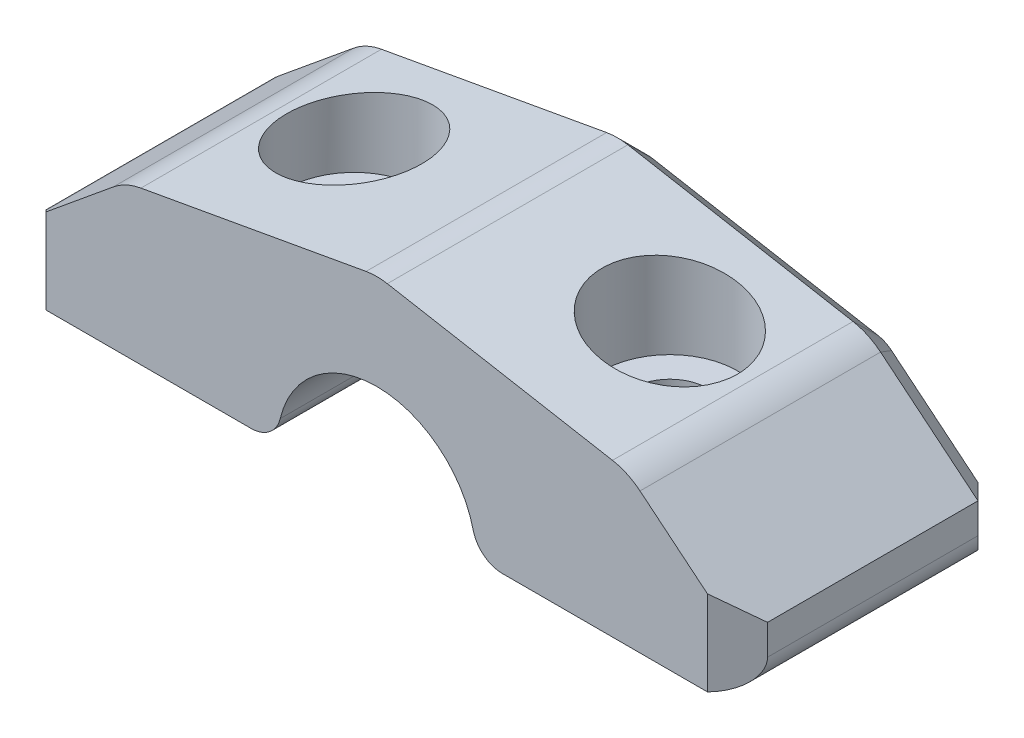
from build123d import *

# Parameters (mm, degrees)
BOSS_EXTRUDE1_DEPTH     = 9
CUT_EXTRUDE1_DEPTH      = 17.347782724
CUT_EXTRUDE1_DEPTH_BACK = 17.347782724
CHAMFER1_SIZE           = 1
FILLET3_R               = 1
SKETCH4_R               = 1.25
CUT_EXTRUDE2_DEPTH      = 17.347782724
CUT_EXTRUDE3_START      = 3
SKETCH5_R               = 2.25
CUT_EXTRUDE3_DEPTH      = 10
FILLET2_R               = 2
CHAMFER2_SIZE           = 1


with BuildPart() as part:
    # Sketch1 → Boss-Extrude1 (new body)
    with BuildSketch(Plane.XY):
        with BuildLine():
            Line((-3.3, 0), (-12, 0))
            Line((-12, 0), (-12, 6.5))
            Line((-12, 6.5), (12, 6.5))
            Line((12, 6.5), (12, 0))
            Line((12, 0), (3.3, 0))
            ThreePointArc((3.3, 0), (0, 3.3), (-3.3, 0))
        make_face()
    extrude(amount=BOSS_EXTRUDE1_DEPTH)

    # Sketch2 → Cut-Extrude1 (cut, two sides: drawn at the far end of the back side and taken through both)
    with BuildSketch(Plane.XY.offset(9).offset(-CUT_EXTRUDE1_DEPTH_BACK)):
        Polygon((-8.355690819, 5), (0, 6.5), (-12, 6.5), (-12, 2.004439372), align=None)
        Polygon((12, 6.5), (0, 6.5), (8.355690819, 5), (12, 2.004439372), align=None)
    extrude(amount=CUT_EXTRUDE1_DEPTH + CUT_EXTRUDE1_DEPTH_BACK, mode=Mode.SUBTRACT)

    # Chamfer1
    chamfer1_edges = [part.edges().sort_by_distance(p)[0] for p in [
        (12, 1.002219686, 9),
        (-12, 1.002219686, 0),
        (-12, 1.002219686, 9),
        (12, 1.002219686, 0),
    ]]
    chamfer(chamfer1_edges, length=CHAMFER1_SIZE)

    # Fillet3
    fillet3_edges = [part.edges().sort_by_distance(p)[0] for p in [
        (12, 0, 4.5),
        (3.3, 0, 4.5),
        (-12, 0, 4.5),
        (-3.3, 0, 4.5),
    ]]
    fillet(fillet3_edges, radius=FILLET3_R)

    # Sketch4 → Cut-Extrude2 (cut, through all)
    with BuildSketch(Plane.XZ):
        with Locations(Location((-5.25, 4.5, 0), (0, 0, 31.315725107))):
            Circle(SKETCH4_R)
        with Locations((5.25, 4.5)):
            Circle(SKETCH4_R)
    extrude(amount=-CUT_EXTRUDE2_DEPTH, mode=Mode.SUBTRACT)

    # Sketch5 → Cut-Extrude3 (cut)
    with BuildSketch(Plane(origin=(0, 0, 0), x_dir=(1, 0, 0), z_dir=(0, 1, 0)).offset(CUT_EXTRUDE3_START)):
        with Locations(Location((-5.25, -4.5, 0), (0, 0, 180))):
            Circle(SKETCH5_R)
        with Locations((5.25, -4.5)):
            Circle(SKETCH5_R)
    extrude(amount=CUT_EXTRUDE3_DEPTH, mode=Mode.SUBTRACT)

    # Fillet2
    fillet2_edges = [part.edges().sort_by_distance(p)[0] for p in [
        (8.355690819, 5, 4.5),
        (-8.355690819, 5, 4.5),
        (0, 6.5, 4.5),
        (-12, 2.004439372, 4.5),
    ]]
    fillet(fillet2_edges, radius=FILLET2_R)

    # Chamfer2
    chamfer2_edges = [part.edges().sort_by_distance(p)[0] for p in [
        (7.591052367, 0, 0),
        (3.562652612, 0.214965561, 0),
        (0, 3.3, 0),
        (-3.562652612, 0.214965561, 0),
        (-7.591052367, 0, 0),
    ]]
    chamfer(chamfer2_edges, length=CHAMFER2_SIZE)
    # the kernel refuses this chamfer: 1 mm, written as the material it takes off along each edge
    with BuildSketch(Plane(origin=(8.758751871, 4.668690619, 0), x_dir=(-0.6347551060767181, -0.7722240167716554, -0.02749587661058638), z_dir=(0.7725160920418075, -0.6349951870183377, 0)), Plane(origin=(-12.986666492, 1.193416171, 0), x_dir=(0.6347551060767181, -0.7722240167716553, -0.02749587661058636), z_dir=(0.7725160920418074, 0.6349951870183378, 0))) as chamfer2_2_piece_1:
        with BuildLine():
            Line((1.028673195, 0), (-0.056547155, -1.027117794))
            Line((-0.056547155, -1.027117794), (-0.076539593, -1.026567876))
            ThreePointArc((-0.076539593, -1.026567876), (-0.034129227, -0.51339783), (-0.019992438, 0.000549918))
            Line((-0.019992438, 0.000549918), (0.000549918, 0.019992438))
            ThreePointArc((0.000549918, 0.019992438), (0.514497665, 0.00585565), (1.029223113, 0.019992438))
            Line((1.029223113, 0.019992438), (1.028673195, 0))
        make_face()
    extrude(amount=5.472914628, mode=Mode.SUBTRACT)
    with BuildSketch(Plane(origin=(7.488761497, 3.123658435, 0), x_dir=(0.6349951870183373, 0.7725160920418078, 0), z_dir=(0.7725160920418078, -0.6349951870183373, 0))) as chamfer2_2_piece_2:
        with BuildLine():
            Line((0.971715729, -0.028284271), (2.028284271, 1.028284271))
            Line((2.028284271, 1.028284271), (2.048284271, 1.028284271))
            ThreePointArc((2.048284271, 1.028284271), (2.02, 0.514142136), (2.02, 0))
            Line((2.02, 0), (2, -0.02))
            ThreePointArc((2, -0.02), (1.485857864, -0.02), (0.971715729, -0.048284271))
            Line((0.971715729, -0.048284271), (0.971715729, -0.028284271))
        make_face()
    revolve(axis=Axis((7.488761497, 3.123658435, 0), (0, 0, 1)), revolution_arc=29.242385329, mode=Mode.SUBTRACT)
    with BuildSketch(Plane(origin=(0.35338761, 6.436560432, 0), x_dir=(-0.176626999834447, -0.9838937339463534, -0.02749587661058635), z_dir=(0.9842658682259174, -0.17669380477391067, 0)), Plane(origin=(-7.842149107, 5.092190171, 0), x_dir=(0.17662699983444718, -0.9838937339463534, -0.027495876610586334), z_dir=(0.9842658682259174, 0.17669380477391086, 0))) as chamfer2_2_piece_3:
        with BuildLine():
            Line((1.028673195, 0), (-0.056547155, -1.027117794))
            Line((-0.056547155, -1.027117794), (-0.076539593, -1.026567876))
            ThreePointArc((-0.076539593, -1.026567876), (-0.034129227, -0.51339783), (-0.019992438, 0.000549918))
            Line((-0.019992438, 0.000549918), (0.000549918, 0.019992438))
            ThreePointArc((0.000549918, 0.019992438), (0.514497665, 0.00585565), (1.029223113, 0.019992438))
            Line((1.029223113, 0.019992438), (1.028673195, 0))
        make_face()
    extrude(amount=7.608474234, mode=Mode.SUBTRACT)
    with BuildSketch(Plane(origin=(0, 4.468028696, 0), x_dir=(0.17669380477391125, 0.9842658682259174, 0), z_dir=(0.9842658682259174, -0.17669380477391125, 0))) as chamfer2_2_piece_4:
        with BuildLine():
            Line((0.971715729, -0.028284271), (2.028284271, 1.028284271))
            Line((2.028284271, 1.028284271), (2.048284271, 1.028284271))
            ThreePointArc((2.048284271, 1.028284271), (2.02, 0.514142136), (2.02, 0))
            Line((2.02, 0), (2, -0.02))
            ThreePointArc((2, -0.02), (1.485857864, -0.02), (0.971715729, -0.048284271))
            Line((0.971715729, -0.048284271), (0.971715729, -0.028284271))
        make_face()
    revolve(axis=Axis((0, 4.468028696, 0), (0, 0, 1)), revolution_arc=20.354484339, mode=Mode.SUBTRACT)
    with BuildSketch(Plane(origin=(-7.488761497, 3.123658435, 0), x_dir=(-0.17669380477391083, 0.9842658682259176, 0), z_dir=(0.9842658682259176, 0.17669380477391083, 0))) as chamfer2_2_piece_5:
        with BuildLine():
            Line((0.971715729, -0.028284271), (2.028284271, 1.028284271))
            Line((2.028284271, 1.028284271), (2.048284271, 1.028284271))
            ThreePointArc((2.048284271, 1.028284271), (2.02, 0.514142136), (2.02, 0))
            Line((2.02, 0), (2, -0.02))
            ThreePointArc((2, -0.02), (1.485857864, -0.02), (0.971715729, -0.048284271))
            Line((0.971715729, -0.048284271), (0.971715729, -0.028284271))
        make_face()
    revolve(axis=Axis((-7.488761497, 3.123658435, 0), (0, 0, 1)), revolution_arc=29.242385329, mode=Mode.SUBTRACT)


solid = part.part
